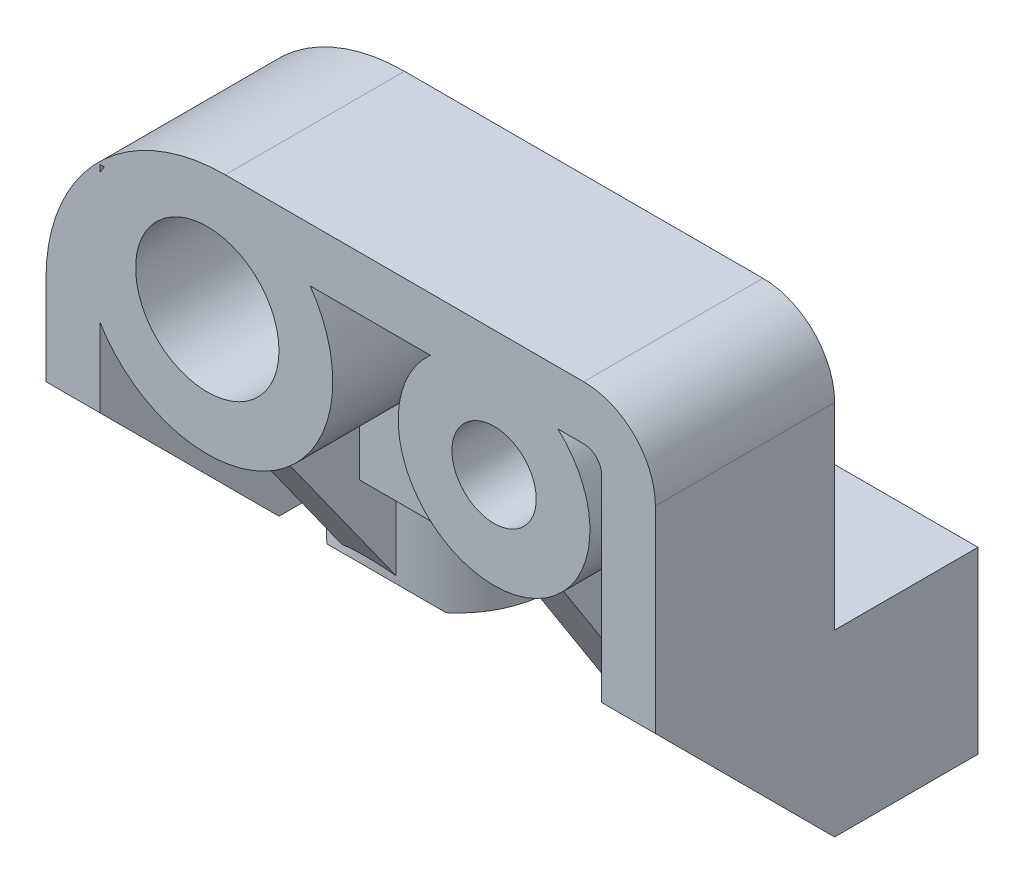
from build123d import *

# Parameters (mm, degrees)
ESQUISSE1_W        = 34
ESQUISSE1_H        = 15
ESQUISSE1_R        = 2.35
ESQUISSE1_R_2      = 4
BOSS_EXTRU_1_DEPTH = 10
ESQUISSE2_W        = 34
ESQUISSE2_H        = 18
ESQUISSE2_R        = 2.2
ESQUISSE2_R_2      = 2
BOSS_EXTRU_2_DEPTH = 10
CHANFREIN2_SIZE    = 10
COQUE1_START       = 3
COQUE1_DEPTH       = 7
COQUE1_START_2     = 1.2
COQUE1_2_OUTLINE_W = 28
COQUE1_2_OUTLINE_H = 7
COQUE1_2_DEPTH     = 1.8
COQUE1_START_3     = -74
COQUE1_3_DEPTH     = 7
CONG_1_R           = 10
CONG_3_R           = 1
CONG_4_R           = 4
NERVURE3_REACH     = 80.746
ESQUISSE4_WALL_W   = 176.697507514
ESQUISSE4_WALL_H   = 3
NERVURE5_REACH     = 80.746
ESQUISSE5_WALL_W   = 178.064946254
ESQUISSE5_WALL_H   = 3


with BuildPart() as part:
    # Esquisse1 → Boss.-Extru.1 (new body)
    with BuildSketch(Plane.XY):
        with Locations((0, -56.5)):
            Rectangle(ESQUISSE1_W, ESQUISSE1_H)
        with Locations((8, -56)):
            Circle(ESQUISSE1_R, mode=Mode.SUBTRACT)
        with Locations((-8, -56)):
            Circle(ESQUISSE1_R_2, mode=Mode.SUBTRACT)
    extrude(amount=BOSS_EXTRU_1_DEPTH)

    # Esquisse2 → Boss.-Extru.2 (add)
    with BuildSketch(Plane.XZ.offset(64)):
        with Locations((0, 1)):
            Rectangle(ESQUISSE2_W, ESQUISSE2_H)
        with Locations(Location((-8, -4, 0), (0, 0, 270))):
            Circle(ESQUISSE2_R, mode=Mode.SUBTRACT)
        with Locations(Location((8, -4, 0), (0, 0, 270))):
            Circle(ESQUISSE2_R_2, mode=Mode.SUBTRACT)
    extrude(amount=BOSS_EXTRU_2_DEPTH)

    # Chanfrein2
    chanfrein2_edges = [part.edges().sort_by_distance(p)[0] for p in [
        (0, -74, 10),
    ]]
    chamfer(chanfrein2_edges, length=CHANFREIN2_SIZE)

    # Coque1: read off the stored shape, not the designer's step
    # Coque1 outline → Coque1 (cut)
    with BuildSketch(Plane.XY.offset(COQUE1_START)):
        with BuildLine():
            Line((14, -74), (14, -52))
            Line((14, -52), (11.552815785, -52))
            ThreePointArc((11.552815785, -52), (8, -61.35), (4.447184215, -52))
            Line((4.447184215, -52), (-2.255437353, -52))
            ThreePointArc((-2.255437353, -52), (-4.19508021, -61.875592344), (-14, -59.605551275))
            Line((-14, -59.605551275), (-14, -74))
            Line((-14, -74), (14, -74))
        make_face()
        with BuildLine():
            ThreePointArc((-14, -52.394448725), (-13.875592344, -52.19508021), (-13.744562647, -52))
            Line((-13.744562647, -52), (-14, -52))
            Line((-14, -52), (-14, -52.394448725))
        make_face()
    extrude(amount=COQUE1_DEPTH, mode=Mode.SUBTRACT)

    # Coque1 2 outline → Coque1 2 (cut)
    with BuildSketch(Plane.XY.offset(COQUE1_START_2)):
        with Locations((0, -70.5)):
            Rectangle(COQUE1_2_OUTLINE_W, COQUE1_2_OUTLINE_H)
    extrude(amount=COQUE1_2_DEPTH, mode=Mode.SUBTRACT)

    # Coque1 3 outline → Coque1 3 (cut)
    with BuildSketch(Plane(origin=(0, 0, 0), x_dir=(1, 0, 0), z_dir=(0, 1, 0)).offset(COQUE1_START_3)):
        with BuildLine():
            ThreePointArc((-2.897059671, 5), (-3.98502802, 0.695457672), (-8, -1.2))
            Line((-8, -1.2), (14, -1.2))
            Line((14, -1.2), (14, 5))
            Line((14, 5), (12.898979486, 5))
            ThreePointArc((12.898979486, 5), (8, -1), (3.101020514, 5))
            Line((3.101020514, 5), (-2.897059671, 5))
        make_face()
        with BuildLine():
            ThreePointArc((-8, -1.2), (-12.01497198, 0.695457672), (-13.102940329, 5))
            Line((-13.102940329, 5), (-14, 5))
            Line((-14, 5), (-14, -1.2))
            Line((-14, -1.2), (-8, -1.2))
        make_face()
    extrude(amount=COQUE1_3_DEPTH, mode=Mode.SUBTRACT)

    # Congé1
    cong_1_edges = [part.edges().sort_by_distance(p)[0] for p in [
        (-17, -49, 5),
    ]]
    fillet(cong_1_edges, radius=CONG_1_R)

    # Congé3
    cong_3_edges = [part.edges().sort_by_distance(p)[0] for p in [
        (14, -52, 6.5),
    ]]
    fillet(cong_3_edges, radius=CONG_3_R)

    # Congé4
    cong_4_edges = [part.edges().sort_by_distance(p)[0] for p in [
        (17, -49, 5),
    ]]
    fillet(cong_4_edges, radius=CONG_4_R)

    # Esquisse4 wall → Nervure3 (add, up to next)
    with BuildSketch(Plane(origin=(-8, -67, 5), x_dir=(0, -0.813733471207, -0.581238193719), z_dir=(0, 0.581238193719, -0.813733471207)), mode=Mode.PRIVATE) as nervure3_sk1:
        Rectangle(ESQUISSE4_WALL_W, ESQUISSE4_WALL_H)
    nervure3_tool1 = extrude(nervure3_sk1.sketch, amount=NERVURE3_REACH, mode=Mode.PRIVATE) - part.part
    add(nervure3_tool1.solids().sort_by_distance((-8, -67, 5))[0])

    # Esquisse5 wall → Nervure5 (add, up to next)
    with BuildSketch(Plane(origin=(8, -66.175, 5), x_dir=(0, -0.842662328893, -0.538442382679), z_dir=(0, 0.538442382679, -0.842662328893)), mode=Mode.PRIVATE) as nervure5_sk1:
        Rectangle(ESQUISSE5_WALL_W, ESQUISSE5_WALL_H)
    nervure5_tool1 = extrude(nervure5_sk1.sketch, amount=NERVURE5_REACH, mode=Mode.PRIVATE) - part.part
    add(nervure5_tool1.solids().sort_by_distance((8, -66.175, 5))[0])


solid = part.part
